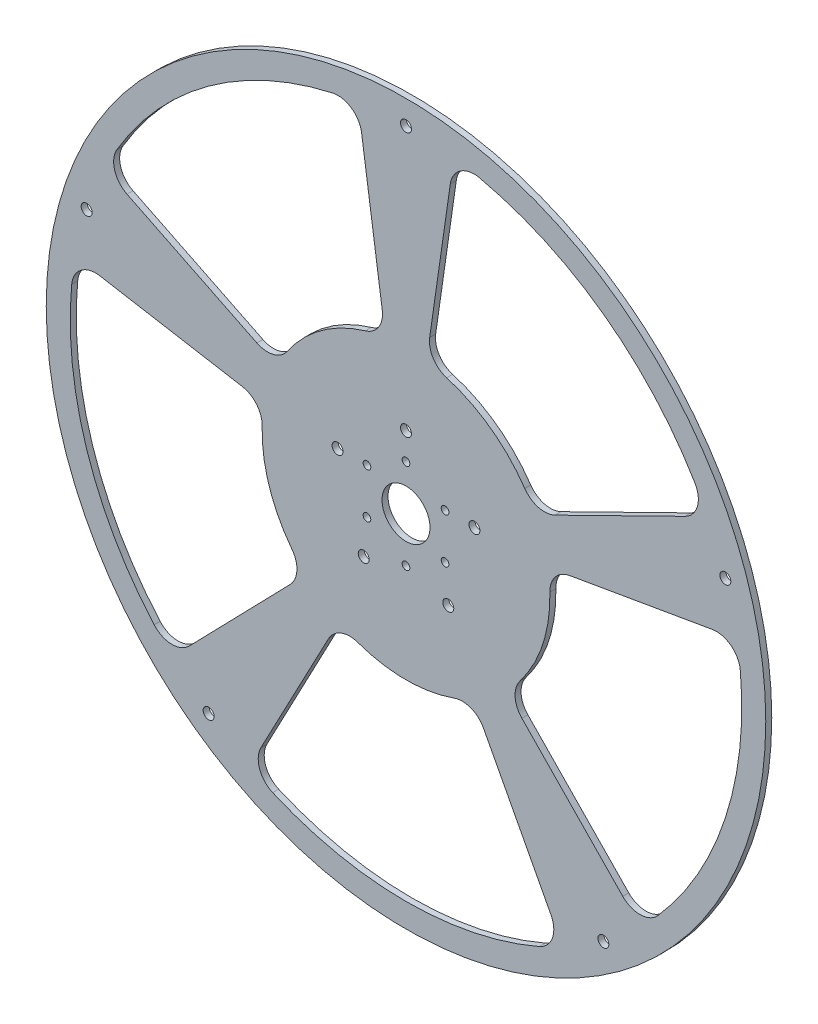
from build123d import *

# Parameters (mm, degrees)
SKETCH1_R           = 190.5
SKETCH1_R_2         = 12.7
SKETCH1_R_3         = 2.9
SKETCH1_R_4         = 2.032
BOSS_EXTRUDE3_DEPTH = 3.175
FILLET1_R           = 12.7
FILLET2_R           = 12.7
FILLET3_R           = 12.7


with BuildPart() as part:
    # Sketch1 → Boss-Extrude3 (new body)
    with BuildSketch(Plane.XY):
        Circle(SKETCH1_R)
        Circle(SKETCH1_R_2, mode=Mode.SUBTRACT)
        with Locations((-36.235253271, 11.773547486)):
            Circle(SKETCH1_R_3, mode=Mode.SUBTRACT)
        with Locations((-22.394618112, -30.823547486)):
            Circle(SKETCH1_R_3, mode=Mode.SUBTRACT)
        with Locations((22.394618112, -30.823547486)):
            Circle(SKETCH1_R_3, mode=Mode.SUBTRACT)
        with Locations((36.235253271, 11.773547486)):
            Circle(SKETCH1_R_3, mode=Mode.SUBTRACT)
        with Locations((0, 38.1)):
            Circle(SKETCH1_R_3, mode=Mode.SUBTRACT)
        with Locations((-169.097848597, 54.9432216)):
            Circle(SKETCH1_R_3, mode=Mode.SUBTRACT)
        with Locations((0, 177.8)):
            Circle(SKETCH1_R_3, mode=Mode.SUBTRACT)
        with Locations((169.097848597, 54.9432216)):
            Circle(SKETCH1_R_3, mode=Mode.SUBTRACT)
        with Locations((104.508217858, -143.8432216)):
            Circle(SKETCH1_R_3, mode=Mode.SUBTRACT)
        with Locations((-104.508217858, -143.8432216)):
            Circle(SKETCH1_R_3, mode=Mode.SUBTRACT)
        with Locations((-20.677222541, 11.938)):
            Circle(SKETCH1_R_4, mode=Mode.SUBTRACT)
        with Locations((0, 23.876)):
            Circle(SKETCH1_R_4, mode=Mode.SUBTRACT)
        with Locations((20.677222541, 11.938)):
            Circle(SKETCH1_R_4, mode=Mode.SUBTRACT)
        with Locations((20.677222541, -11.938)):
            Circle(SKETCH1_R_4, mode=Mode.SUBTRACT)
        with Locations((0, -23.876)):
            Circle(SKETCH1_R_4, mode=Mode.SUBTRACT)
        with Locations((-20.677222541, -11.938)):
            Circle(SKETCH1_R_4, mode=Mode.SUBTRACT)
        with BuildLine():
            Line((25.335121222, 175.985714286), (10.857909095, 75.42244898))
            ThreePointArc((10.857909095, 75.42244898), (44.789236225, 61.647094971), (68.375733143, 33.63330369))
            Line((68.375733143, 33.63330369), (159.543377334, 78.477708611))
            ThreePointArc((159.543377334, 78.477708611), (104.508217858, 143.8432216), (25.335121222, 175.985714286))
        make_face(mode=Mode.SUBTRACT)
        with BuildLine():
            Line((-25.4, 175.976362049), (-10.885714286, 75.418440878))
            ThreePointArc((-10.885714286, 75.418440878), (-44.800599154, 61.63883772), (-68.375733143, 33.63330369))
            Line((-68.375733143, 33.63330369), (-159.543377334, 78.477708611))
            ThreePointArc((-159.543377334, 78.477708611), (-104.53473136, 143.823954679), (-25.4, 175.976362049))
        make_face(mode=Mode.SUBTRACT)
        with BuildLine():
            Line((75.086290011, 12.980333294), (175.201343359, 30.287444352))
            ThreePointArc((175.201343359, 30.287444352), (169.097848597, -54.9432216), (123.938351095, -127.483823005))
            Line((123.938351095, -127.483823005), (53.116436183, -54.635924145))
            ThreePointArc((53.116436183, -54.635924145), (72.470506542, -23.547094971), (75.086290011, 12.980333294))
        make_face(mode=Mode.SUBTRACT)
        with BuildLine():
            Line((35.547970221, -67.400161819), (82.945263848, -157.267044244))
            ThreePointArc((82.945263848, -157.267044244), (0, -177.8), (-82.945263848, -157.267044244))
            Line((-82.945263848, -157.267044244), (-35.547970221, -67.400161819))
            ThreePointArc((-35.547970221, -67.400161819), (0, -76.2), (35.547970221, -67.400161819))
        make_face(mode=Mode.SUBTRACT)
        with BuildLine():
            Line((-175.201343359, 30.287444352), (-75.086290011, 12.980333294))
            ThreePointArc((-75.086290011, 12.980333294), (-72.470506542, -23.547094971), (-53.116436183, -54.635924145))
            Line((-53.116436183, -54.635924145), (-123.938351095, -127.483823005))
            ThreePointArc((-123.938351095, -127.483823005), (-169.097848597, -54.9432216), (-175.201343359, 30.287444352))
        make_face(mode=Mode.SUBTRACT)
    extrude(amount=BOSS_EXTRUDE3_DEPTH)

    # Fillet1
    fillet1_edges = [part.edges().sort_by_distance(p)[0] for p in [
        (-175.201343359, 30.287444352, 1.5875),
    ]]
    fillet(fillet1_edges, radius=FILLET1_R)

    # Fillet2
    fillet2_edges = [part.edges().sort_by_distance(p)[0] for p in [
        (35.547970221, -67.400161819, 1.5875),
        (123.938351095, -127.483823005, 1.5875),
        (53.116436183, -54.635924145, 1.5875),
        (75.086290011, 12.980333294, 1.5875),
        (175.201343359, 30.287444352, 1.5875),
        (68.375733143, 33.63330369, 1.5875),
        (159.543377334, 78.477708611, 1.5875),
        (25.335121222, 175.985714286, 1.5875),
        (10.857909095, 75.42244898, 1.5875),
        (-10.885714286, 75.418440878, 1.5875),
        (-68.375733143, 33.63330369, 1.5875),
        (-25.4, 175.976362049, 1.5875),
        (-159.543377334, 78.477708611, 1.5875),
    ]]
    fillet(fillet2_edges, radius=FILLET2_R)

    # Fillet3
    fillet3_edges = [part.edges().sort_by_distance(p)[0] for p in [
        (-75.086290011, 12.980333294, 1.5875),
        (-123.938351095, -127.483823005, 1.5875),
        (-53.116436183, -54.635924145, 1.5875),
        (82.945263848, -157.267044244, 1.5875),
        (-82.945263848, -157.267044244, 1.5875),
        (-35.547970221, -67.400161819, 1.5875),
    ]]
    fillet(fillet3_edges, radius=FILLET3_R)


solid = part.part
